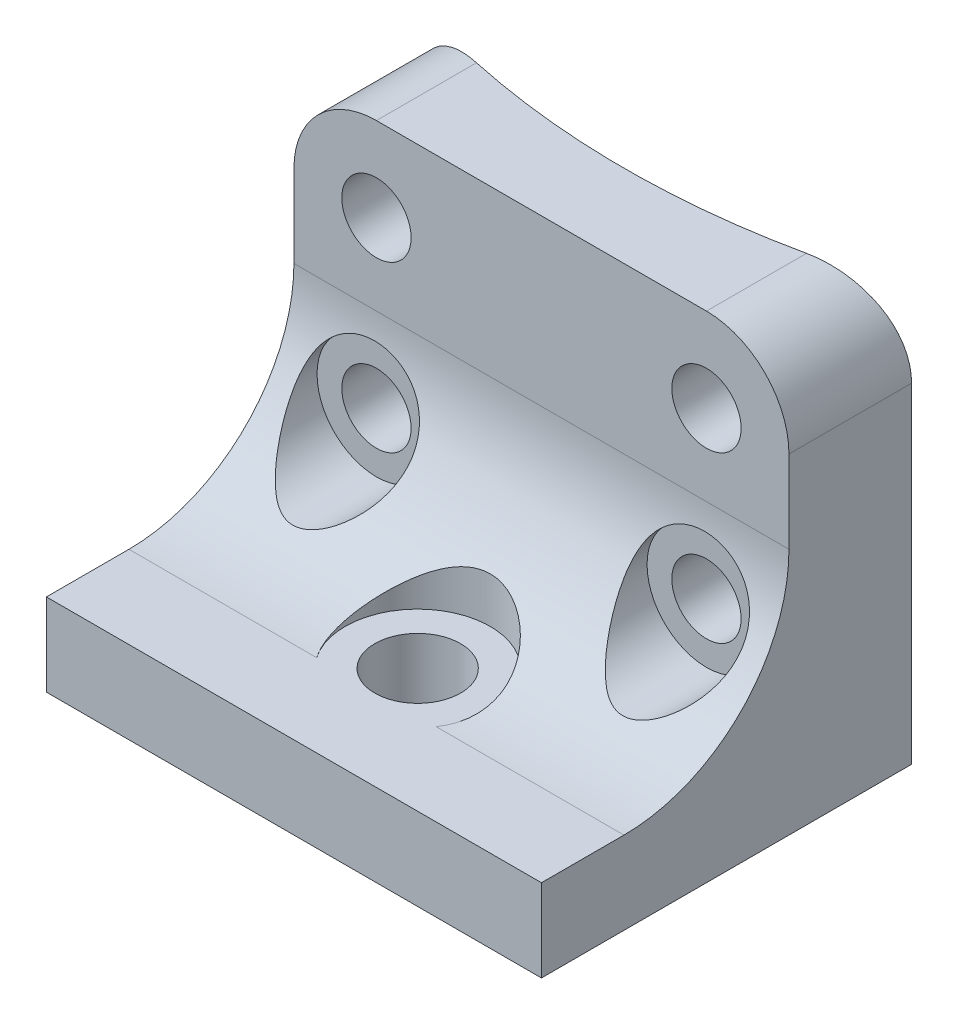
from build123d import *

# Parameters (mm, degrees)
SKETCH1_R           = 2.1
BOSS_EXTRUDE1_DEPTH = 5
SKETCH3_W           = 30
SKETCH3_H           = 5
BOSS_EXTRUDE2_DEPTH = 15
SKETCH4_R           = 2.6
CUT_EXTRUDE2_DEPTH  = 108.425323176
FILLET2_R           = 10
SKETCH5_R           = 4.4
CUT_EXTRUDE3_DEPTH  = 108.425323272
SKETCH2_R           = 3.6
CUT_EXTRUDE4_DEPTH  = 114.974558916
BOSS_EXTRUDE3_DEPTH = 25
FILLET3_R           = 5
SKETCH7_R           = 2.1
CUT_EXTRUDE5_DEPTH  = 114.974558956


with BuildPart() as part:
    # Sketch1 → Boss-Extrude1 (new body)
    with BuildSketch(Plane.XY):
        Polygon((73.634936481, -21), (73.634936481, -20), (103.634936481, -20), (103.634936481, -21), (103.634936481, -45), (73.634936481, -45), align=None)
        with Locations((98.634936481, -35.1)):
            Circle(SKETCH1_R, mode=Mode.SUBTRACT)
        with Locations((78.634936481, -35.1)):
            Circle(SKETCH1_R, mode=Mode.SUBTRACT)
        with Locations((98.634936481, -25.1)):
            Circle(SKETCH1_R, mode=Mode.SUBTRACT)
        with Locations((78.634936481, -25.1)):
            Circle(SKETCH1_R, mode=Mode.SUBTRACT)
    extrude(amount=BOSS_EXTRUDE1_DEPTH)

    # Sketch3 → Boss-Extrude2 (add)
    with BuildSketch(Plane.XY.offset(5)):
        with Locations((88.634936481, -42.5)):
            Rectangle(SKETCH3_W, SKETCH3_H)
    extrude(amount=BOSS_EXTRUDE2_DEPTH)

    # Sketch4 → Cut-Extrude2 (cut, through all)
    with BuildSketch(Plane(origin=(0, -40, 0), x_dir=(1, 0, 0), z_dir=(0, 1, 0))):
        with Locations(Location((88.634936481, -12.5, 0), (0, 0, 180))):
            Circle(SKETCH4_R)
    extrude(amount=-CUT_EXTRUDE2_DEPTH, mode=Mode.SUBTRACT)

    # Fillet2
    # the kernel refuses this fillet: 10 mm, written as the material it adds along each edge
    with BuildSketch(Plane(origin=(73.634936481, -40, 5), x_dir=(0, 0, 1), z_dir=(1, 0, 0))) as fillet2_piece_1_section:
        with BuildLine():
            CenterArc((FILLET2_R, -FILLET2_R), FILLET2_R, 90, 90)
            Line((0, -FILLET2_R), (0, 0))
            Line((0, 0), (FILLET2_R, 0))
        make_face()
    fillet2_piece_1 = extrude(amount=30, mode=Mode.PRIVATE)
    fillet2_piece_1 = fillet2_piece_1 - Plane(origin=(88.634936481, -37.846712749, 12.5), x_dir=(-1, 0, 0), z_dir=(0, 1, 0)) * Cylinder(2.6, 100, mode=Mode.PRIVATE)
    fillet2_piece_1 = fillet2_piece_1 - Plane(origin=(98.634936481, -35.1, 7.280393082), x_dir=(1, 0, 0), z_dir=(0, 0, -1)) * Cylinder(2.1, 100, mode=Mode.PRIVATE)
    fillet2_piece_1 = fillet2_piece_1 - Plane(origin=(78.634936481, -35.1, 7.280393082), x_dir=(1, 0, 0), z_dir=(0, 0, -1)) * Cylinder(2.1, 100, mode=Mode.PRIVATE)
    add(fillet2_piece_1)

    # Sketch5 → Cut-Extrude3 (cut, through all)
    with BuildSketch(Plane(origin=(0, -40, 0), x_dir=(1, 0, 0), z_dir=(0, 1, 0))):
        with Locations((88.634936481, -12.5)):
            Circle(SKETCH5_R)
    extrude(amount=CUT_EXTRUDE3_DEPTH, mode=Mode.SUBTRACT)

    # Sketch2 → Cut-Extrude4 (cut, through all)
    with BuildSketch(Plane.XY.offset(5)):
        with Locations((98.634936481, -25.1)):
            Circle(SKETCH2_R)
        with Locations(Location((98.634936481, -35.1, 0), (0, 0, 180))):
            Circle(SKETCH2_R)
        with Locations((78.634936481, -25.1)):
            Circle(SKETCH2_R)
        with Locations(Location((78.634936481, -35.1, 0), (0, 0, 180))):
            Circle(SKETCH2_R)
    extrude(amount=CUT_EXTRUDE4_DEPTH, mode=Mode.SUBTRACT)

    # Sketch6 → Boss-Extrude3 (add)
    with BuildSketch(Plane.XZ.offset(45)):
        with BuildLine():
            Line((88.634936481, 0), (73.634936481, 0))
            Line((73.634936481, 0), (73.634936481, -2.430609057))
            ThreePointArc((73.634936481, -2.430609057), (81.037110141, -0.611589546), (88.634936481, 0))
        make_face()
        with BuildLine():
            Line((103.634936481, 0), (88.634936481, 0))
            ThreePointArc((88.634936481, 0), (96.232762821, -0.611589546), (103.634936481, -2.430609057))
            Line((103.634936481, -2.430609057), (103.634936481, 0))
        make_face()
    extrude(amount=-BOSS_EXTRUDE3_DEPTH)

    # Fillet3
    fillet3_edges = [part.edges().sort_by_distance(p)[0] for p in [
        (103.634936481, -20, 1.284695471),
        (73.634936481, -20, 1.284695471),
    ]]
    fillet(fillet3_edges, radius=FILLET3_R)

    # Sketch7 → Cut-Extrude5 (cut, through all)
    with BuildSketch(Plane.XY.offset(5)):
        with Locations((98.634936481, -35.1)):
            Circle(SKETCH7_R)
        with Locations((98.634936481, -25.1)):
            Circle(SKETCH7_R)
        with Locations((78.634936481, -25.1)):
            Circle(SKETCH7_R)
        with Locations((78.634936481, -35.1)):
            Circle(SKETCH7_R)
    extrude(amount=-CUT_EXTRUDE5_DEPTH, mode=Mode.SUBTRACT)


solid = part.part
